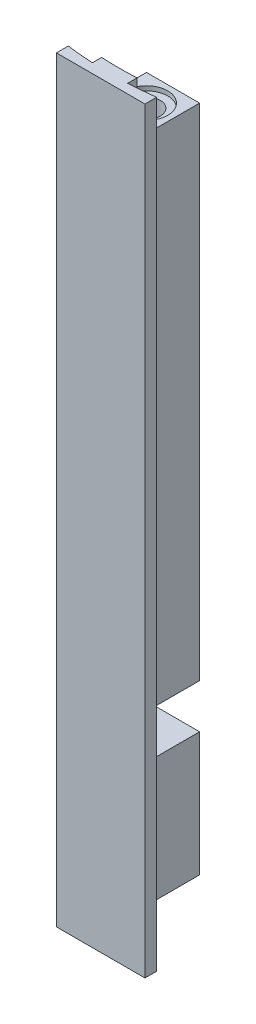
from build123d import *

# Parameters (mm, degrees)
BOSS_EXTRUDE2_DEPTH = 75.5
BOSS_EXTRUDE3_DEPTH = 85.5
SKETCH7_W           = 37.5
SKETCH7_H           = 5
SKETCH9_R           = 1.55
CUT_EXTRUDE4_DEPTH  = 4.3
SKETCH10_R          = 2.4
CUT_EXTRUDE5_DEPTH  = 0.5
SKETCH13_R          = 2.4
CUT_EXTRUDE6_DEPTH  = 0.5
SKETCH14_R          = 1.55
CUT_EXTRUDE7_DEPTH  = 4.3


with BuildPart() as part:
    # Sketch3 → Boss-Extrude2 (new body)
    with BuildSketch(Plane.XZ.offset(5)):
        with BuildLine():
            Line((-3, 37.379807383), (-3, 31.379807383))
            Line((-3, 31.379807383), (3, 31.379807383))
            Line((3, 31.379807383), (3, 37.379807383))
            ThreePointArc((3, 37.379807383), (0, 37.5), (-3, 37.379807383))
        make_face()
    extrude(amount=BOSS_EXTRUDE2_DEPTH)

    # Sketch5 → Boss-Extrude3 (add)
    with BuildSketch(Plane(origin=(0, 0, 0), x_dir=(1, 0, 0), z_dir=(0, 1, 0))):
        with BuildLine():
            Line((-4.999992875, -38.210592422), (-4.999992875, -39.236412732))
            Line((-4.999992875, -39.236412732), (-4.999992875, -39.553710481))
            Line((-4.999992875, -39.553710481), (0, -39.553710481))
            Line((0, -39.553710481), (5.000007125, -39.553710481))
            Line((5.000007125, -39.553710481), (5.000007125, -39.236410916))
            Line((5.000007125, -39.236410916), (5.000007125, -38.231534944))
            ThreePointArc((5.000007125, -38.231534944), (3.502677828, -38.397676797), (2.00000116, -38.50519875))
            Line((2.00000116, -38.50519875), (2.00000116, -37.446628625))
            ThreePointArc((2.00000116, -37.446628625), (0, -37.5), (-2.00000116, -37.446628625))
            Line((-2.00000116, -37.446628625), (-2.00000116, -38.4844033))
            ThreePointArc((-2.00000116, -38.4844033), (-3.502673582, -38.376823472), (-4.999992875, -38.210592422))
        make_face()
    extrude(amount=-BOSS_EXTRUDE3_DEPTH)

    # Sketch7 → Cut-Revolve1 (revolve, cut)
    with BuildSketch(Plane(origin=(0, 0, 0), x_dir=(0, 0, -1), z_dir=(1, 0, 0))):
        with Locations((-18.75, -64)):
            Rectangle(SKETCH7_W, SKETCH7_H)
    revolve(axis=Axis((0, -27.016689378, 0), (0, -1, 0)), mode=Mode.SUBTRACT)

    # Sketch9 → Cut-Extrude4 (cut)
    with BuildSketch(Plane(origin=(0, -80.5, 0), x_dir=(-1, 0, 0), z_dir=(0, -1, 0))):
        with Locations((0, -34.420864201)):
            Circle(SKETCH9_R)
    extrude(amount=-CUT_EXTRUDE4_DEPTH, mode=Mode.SUBTRACT)

    # Sketch10 → Cut-Extrude5 (cut)
    with BuildSketch(Plane(origin=(0, -80.5, 0), x_dir=(-1, 0, 0), z_dir=(0, -1, 0))):
        with Locations((0, -34.420864201)):
            Circle(SKETCH10_R)
    extrude(amount=-CUT_EXTRUDE5_DEPTH, mode=Mode.SUBTRACT)

    # Sketch13 → Cut-Extrude6 (cut)
    with BuildSketch(Plane(origin=(0, -5, 0), x_dir=(-1, 0, 0), z_dir=(0, -1, 0))):
        with Locations((0, -34.379807383)):
            Circle(SKETCH13_R)
    extrude(amount=CUT_EXTRUDE6_DEPTH, mode=Mode.SUBTRACT)

    # Sketch14 → Cut-Extrude7 (cut)
    with BuildSketch(Plane(origin=(0, -5, 0), x_dir=(-1, 0, 0), z_dir=(0, -1, 0))):
        with Locations((0, -34.379807383)):
            Circle(SKETCH14_R)
    extrude(amount=CUT_EXTRUDE7_DEPTH, mode=Mode.SUBTRACT)


solid = part.part
